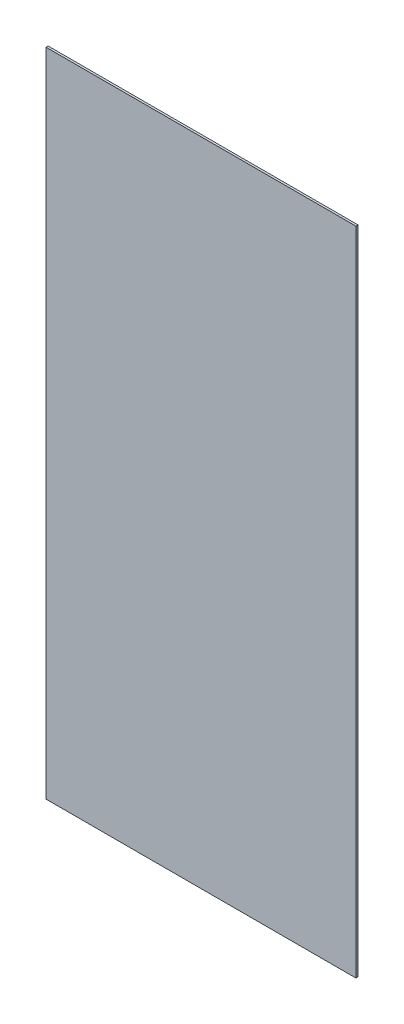
from build123d import *

# Parameters (mm, degrees)
SKETCH1_W           = 290
SKETCH1_H           = 609.6
BOSS_EXTRUDE1_DEPTH = 2


with BuildPart() as part:
    # Sketch1 → Boss-Extrude1 (new body)
    with BuildSketch(Plane.XY):
        Rectangle(SKETCH1_W, SKETCH1_H)
    extrude(amount=BOSS_EXTRUDE1_DEPTH)


solid = part.part
